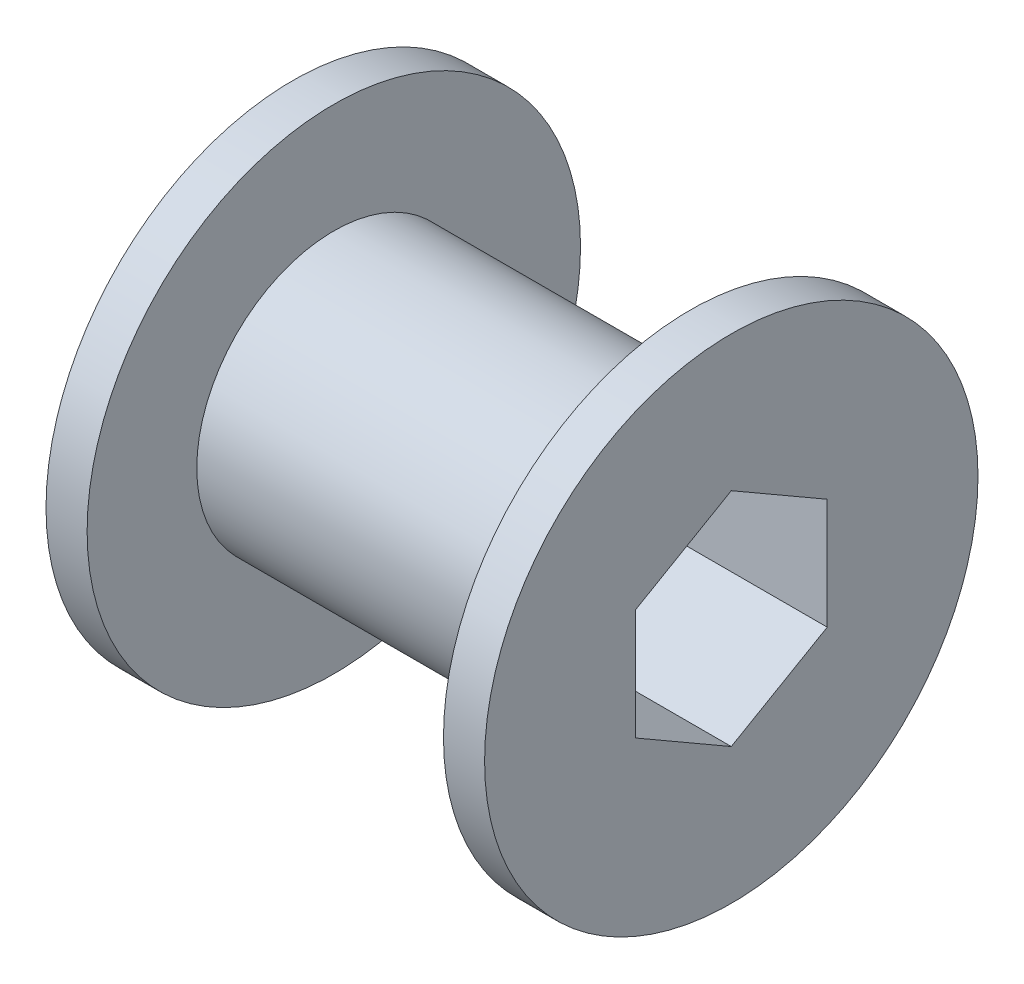
from build123d import *

# Parameters (mm, degrees)
SKETCH1_R           = 2.5
BOSS_EXTRUDE1_DEPTH = 4
SKETCH2_R           = 4.5
BOSS_EXTRUDE2_DEPTH = 0.75
M1_6_NUT_DEPTH      = 8.516648189
M1_6_NUT_DEPTH_BACK = 8.516648189


with BuildPart() as part:
    # Sketch1 → Boss-Extrude1 (new, symmetric)
    with BuildSketch(Plane(origin=(0, 0, 0), x_dir=(0, 0, -1), z_dir=(1, 0, 0))):
        Circle(SKETCH1_R)
    extrude(amount=BOSS_EXTRUDE1_DEPTH, both=True)

    # Sketch2 → Boss-Extrude2 (add)
    with BuildSketch(Plane(origin=(4, 0, 0), x_dir=(0, 0, -1), z_dir=(1, 0, 0))):
        Circle(SKETCH2_R)
    boss_extrude2 = extrude(amount=-BOSS_EXTRUDE2_DEPTH)

    # Mirror1: Boss-Extrude2 across plane
    add(boss_extrude2.mirror(Plane(origin=(0, 0, 0), x_dir=(0, 0, 1), z_dir=(1, 0, 0))))

    # Sketch3 → M1.6 Nut (cut, two sides: drawn at the far end of the back side and taken through both)
    with BuildSketch(Plane(origin=(0, 0, 0), x_dir=(0, 0, -1), z_dir=(1, 0, 0)).offset(-M1_6_NUT_DEPTH_BACK)):
        Polygon((1.75, 0), (1.75, 1.010362971), (0.875, 1.515544457), (0, 2.020725942), (-0.875, 1.515544457), (-1.75, 1.010362971), (-1.75, 0), (-1.75, -1.010362971), (-0.875, -1.515544457), (0, -2.020725942), (0.875, -1.515544457), (1.75, -1.010362971), align=None)
    extrude(amount=M1_6_NUT_DEPTH + M1_6_NUT_DEPTH_BACK, mode=Mode.SUBTRACT)


solid = part.part
